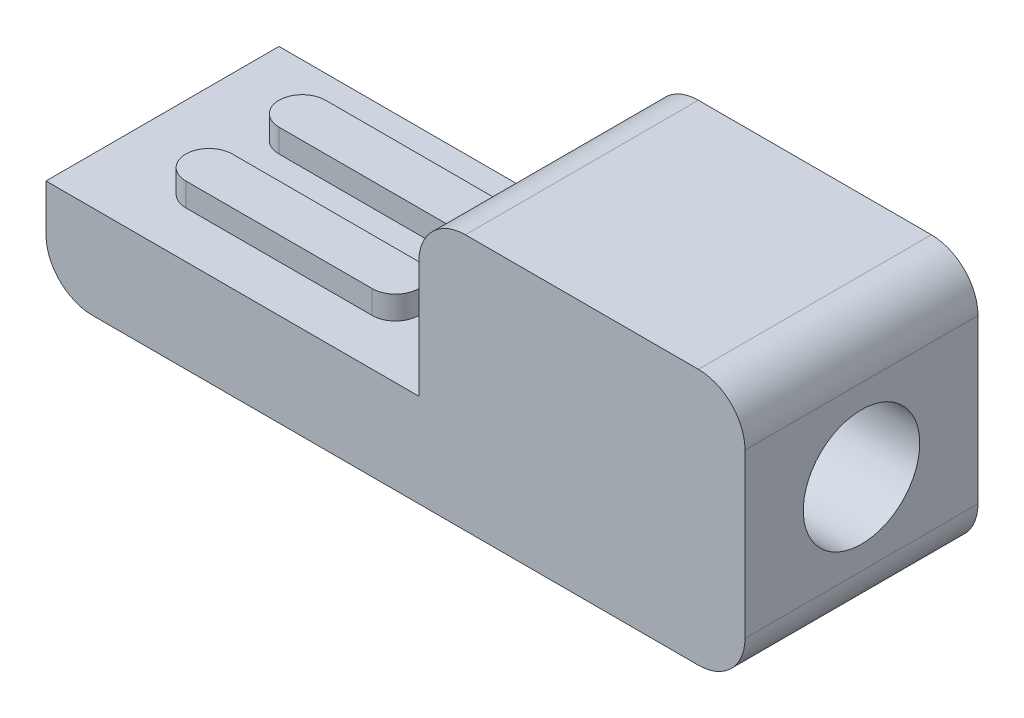
from build123d import *

# Parameters (mm, degrees)
EXTRUDE_1_DEPTH        = 2.5
FILLET_1_R             = 1
HOLE_WIZARD_M3_1_D     = 2.5
HOLE_WIZARD_M3_1_DEPTH = 5
HOLE_WIZARD_M3_1_TIP   = 0.751075774
EXTRUDE_2_DEPTH        = 0.5


with BuildPart() as part:
    # 스케치1 → 보스-돌출1 (new, symmetric)
    with BuildSketch(Plane.XY):
        Polygon((0, 0), (-15, 0), (-15, 2), (-7, 2), (-7, 5.5), (0, 5.5), align=None)
    extrude(amount=EXTRUDE_1_DEPTH, both=True)

    # 필렛1
    fillet_1_edges = [part.edges().sort_by_distance(p)[0] for p in [
        (-7, 5.5, 0),
        (0, 0, 0),
        (0, 5.5, 0),
        (-15, 0, 0),
    ]]
    fillet(fillet_1_edges, radius=FILLET_1_R)

    # M3 나사 구멍1
    with Locations(Plane(origin=(0, 0, 0), x_dir=(0, 0, -1), z_dir=(1, 0, 0))):
        with Locations((0, 2.75)):
            Hole(HOLE_WIZARD_M3_1_D / 2, depth=HOLE_WIZARD_M3_1_DEPTH)
            with Locations((0, 0, -(HOLE_WIZARD_M3_1_DEPTH + HOLE_WIZARD_M3_1_TIP / 2))):  # 118° drill point
                Cone(0, HOLE_WIZARD_M3_1_D / 2, HOLE_WIZARD_M3_1_TIP, mode=Mode.SUBTRACT)

    # 스케치4 → 보스-돌출2 (add)
    with BuildSketch(Plane(origin=(0, 2, 0), x_dir=(1, 0, 0), z_dir=(0, 1, 0))):
        with BuildLine():
            Line((-13, 1.5), (-9, 1.5))
            ThreePointArc((-9, 1.5), (-8.5, 1), (-9, 0.5))
            Line((-9, 0.5), (-13, 0.5))
            ThreePointArc((-13, 0.5), (-13.5, 1), (-13, 1.5))
        make_face()
        with BuildLine():
            Line((-13, -1.5), (-9, -1.5))
            ThreePointArc((-9, -1.5), (-8.5, -1), (-9, -0.5))
            Line((-9, -0.5), (-13, -0.5))
            ThreePointArc((-13, -0.5), (-13.5, -1), (-13, -1.5))
        make_face()
    extrude(amount=EXTRUDE_2_DEPTH)


solid = part.part
